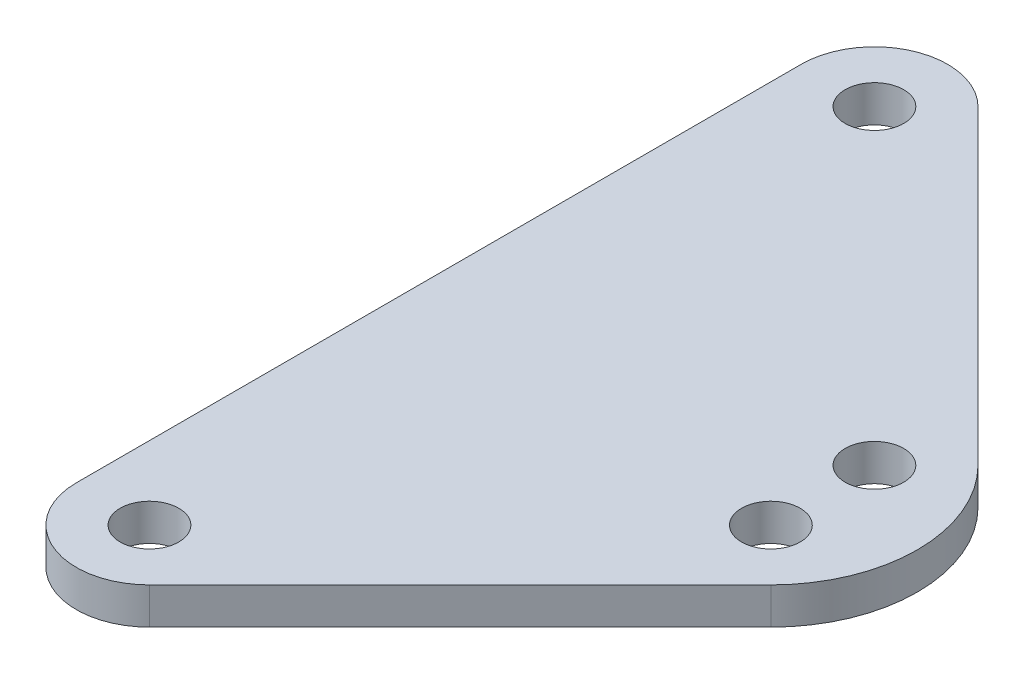
from build123d import *

# Parameters (mm, degrees)
SKETCH1_R           = 8
BOSS_EXTRUDE1_DEPTH = 10


with BuildPart() as part:
    # Sketch1 → Boss-Extrude1 (new body)
    with BuildSketch(Plane(origin=(0, 0, 0), x_dir=(1, 0, 0), z_dir=(0, 1, 0))):
        with BuildLine():
            Line((34.142135624, 34.142135624), (118.994949366, 118.994949366))
            ThreePointArc((118.994949366, 118.994949366), (130.710678119, 147.279220614), (118.994949366, 175.563491861))
            Line((118.994949366, 175.563491861), (34.142135624, 260.416305603))
            ThreePointArc((34.142135624, 260.416305603), (12.346331353, 264.75176063), (0, 246.27416998))
            Line((0, 246.27416998), (0, 48.284271247))
            ThreePointArc((0, 48.284271247), (12.346331353, 29.806680597), (34.142135624, 34.142135624))
        make_face()
        with Locations((20, 48.284271247)):
            Circle(SKETCH1_R, mode=Mode.SUBTRACT)
        with Locations((104.852813742, 133.13708499)):
            Circle(SKETCH1_R, mode=Mode.SUBTRACT)
        with Locations((104.852813742, 161.421356237)):
            Circle(SKETCH1_R, mode=Mode.SUBTRACT)
        with Locations((20, 246.27416998)):
            Circle(SKETCH1_R, mode=Mode.SUBTRACT)
    extrude(amount=BOSS_EXTRUDE1_DEPTH)


solid = part.part
